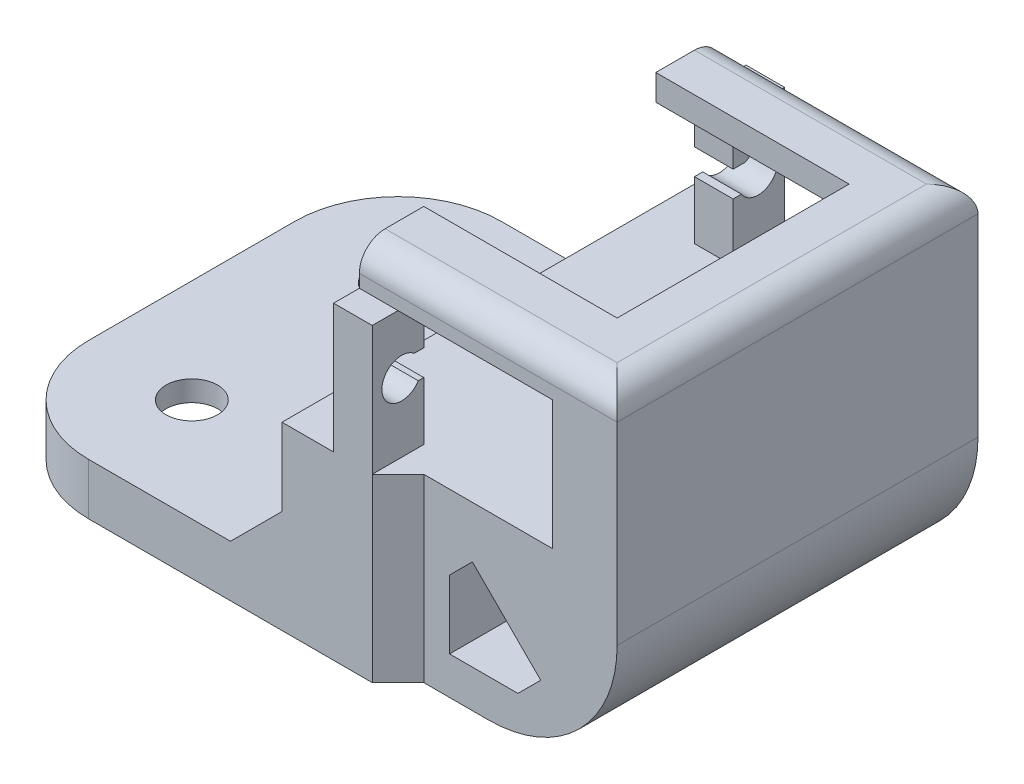
from build123d import *

# Parameters (mm, degrees)
SKETCH1_W           = 59.69
SKETCH1_H           = 50.8
BOSS_EXTRUDE1_DEPTH = 5.08
SKETCH2_W           = 30.48
SKETCH2_H           = 50.8
BOSS_EXTRUDE2_DEPTH = 12.7
SKETCH3_W           = 25.4
SKETCH3_H           = 35.56
BOSS_EXTRUDE3_DEPTH = 16.51
SKETCH5_W           = 30.48
SKETCH5_H           = 13.97
CUT_EXTRUDE1_DEPTH  = 20.32
FILLET2_R           = 2.54
FILLET3_R           = 12.7
CUT_EXTRUDE4_DEPTH  = 48.514
SKETCH12_W          = 3.81
SKETCH12_H          = 12.7
BOSS_EXTRUDE5_DEPTH = 2.54
SKETCH13_W          = 3.175
SKETCH13_H          = 2.54
CUT_EXTRUDE5_DEPTH  = 4.318
SKETCH14_R          = 2.54
CUT_EXTRUDE6_DEPTH  = 14.732
CUT_EXTRUDE7_START  = -3.048
SKETCH15_R          = 2.54
CUT_EXTRUDE7_DEPTH  = 3.048
CUT_EXTRUDE8_DEPTH  = 10.16
CUT_EXTRUDE9_START  = -17.78
CUT_EXTRUDE9_DEPTH  = 17.78
CHAMFER8_SIZE       = 2.54
CHAMFER9_SIZE       = 5.08
SKETCH20_W          = 22.86
SKETCH20_H          = 2.54
CUT_EXTRUDE10_DEPTH = 19.05
FILLET4_R           = 10.16
CUT_EXTRUDE11_DEPTH = 45.212


# Read off the part's stored shape, not the designer's step: Cut-Extrude9
with BuildPart() as part:
    # Sketch1 → Boss-Extrude1 (new body)
    with BuildSketch(Plane(origin=(0, 0, 0), x_dir=(1, 0, 0), z_dir=(0, 1, 0))):
        with Locations((29.845, 25.4)):
            Rectangle(SKETCH1_W, SKETCH1_H)
    extrude(amount=BOSS_EXTRUDE1_DEPTH)

    # Sketch2 → Boss-Extrude2 (add)
    with BuildSketch(Plane(origin=(0, 5.08, 0), x_dir=(1, 0, 0), z_dir=(0, 1, 0))):
        with Locations((44.45, 25.4)):
            Rectangle(SKETCH2_W, SKETCH2_H)
    extrude(amount=BOSS_EXTRUDE2_DEPTH)

    # Sketch3 → Boss-Extrude3 (add)
    with BuildSketch(Plane(origin=(0, 17.78, 0), x_dir=(1, 0, 0), z_dir=(0, 1, 0))):
        with Locations((46.99, 25.4)):
            Rectangle(SKETCH3_W, SKETCH3_H)
    extrude(amount=BOSS_EXTRUDE3_DEPTH)

    # Sketch5 → Cut-Extrude1 (cut)
    with BuildSketch(Plane.ZY.offset(-34.29)):
        with Locations((-25.4, 24.765)):
            Rectangle(SKETCH5_W, SKETCH5_H)
    extrude(amount=-CUT_EXTRUDE1_DEPTH, mode=Mode.SUBTRACT)

    # Fillet2
    fillet2_edges = [part.edges().sort_by_distance(p)[0] for p in [
        (59.69, 34.29, -25.4),
        (46.99, 34.29, -7.62),
        (46.99, 34.29, -43.18),
    ]]
    fillet(fillet2_edges, radius=FILLET2_R)

    # Fillet3
    fillet3_edges = [part.edges().sort_by_distance(p)[0] for p in [
        (59.69, 0, -25.4),
    ]]
    fillet(fillet3_edges, radius=FILLET3_R)

    # Sketch11 → Cut-Extrude4 (cut)
    with BuildSketch(Plane.XY.offset(-7.62)):
        Polygon((45.72, 17.78), (53.34, 17.78), (53.34, 30.48), (45.72, 30.48), (38.1, 30.48), (38.1, 17.78), align=None)
    extrude(amount=-CUT_EXTRUDE4_DEPTH, mode=Mode.SUBTRACT)

    # Sketch12 → Boss-Extrude5 (add)
    with BuildSketch(Plane.XY.offset(-7.62)):
        with Locations((36.195, 24.13)):
            Rectangle(SKETCH12_W, SKETCH12_H)
    boss_extrude5 = extrude(amount=BOSS_EXTRUDE5_DEPTH)

    # Sketch13 → Cut-Extrude5 (cut)
    with BuildSketch(Plane.ZY.offset(-34.29)):
        with Locations((-8.5725, 24.765)):
            Rectangle(SKETCH13_W, SKETCH13_H)
    cut_extrude5 = extrude(amount=-CUT_EXTRUDE5_DEPTH, mode=Mode.SUBTRACT)

    # Mirror6: Boss-Extrude5, Cut-Extrude5 across plane
    add(boss_extrude5.mirror(Plane(origin=(0, 0, -25.4), x_dir=(1, 0, 0), z_dir=(0, 0, -1))))
    add(cut_extrude5.mirror(Plane(origin=(0, 0, -25.4), x_dir=(1, 0, 0), z_dir=(0, 0, -1))), mode=Mode.SUBTRACT)

    # Sketch14 → Cut-Extrude6 (cut)
    with BuildSketch(Plane(origin=(0, 5.08, 0), x_dir=(1, 0, 0), z_dir=(0, 1, 0))):
        with Locations(Location((10.16, 15.24, 0), (0, 0, 270))):
            Circle(SKETCH14_R)
        with Locations((10.16, 39.24)):
            Circle(SKETCH14_R)
        with Locations((10.16, 35.24)):
            Circle(SKETCH14_R)
    extrude(amount=-CUT_EXTRUDE6_DEPTH, mode=Mode.SUBTRACT)

    # Sketch15 → Cut-Extrude7 (cut)
    # profile 1 of 6: a face of its own
    with BuildSketch(Plane.XZ.offset(CUT_EXTRUDE7_START)):
        with BuildLine():
            ThreePointArc((9.51, -22.611397425), (13.149879796, -22.009092908), (16.046575957, -19.724219386))
            ThreePointArc((16.046575957, -19.724219386), (16.636280729, -18.820193838), (17.08820323, -17.84))
            ThreePointArc((17.08820323, -17.84), (17.441095519, -16.561229748), (17.56, -15.24))
            ThreePointArc((17.56, -15.24), (15.617563559, -10.242500625), (10.81, -7.868602575))
            ThreePointArc((10.81, -7.868602575), (10.16, -7.84), (9.51, -7.868602575))
            ThreePointArc((9.51, -7.868602575), (8.519960283, -8.024026765), (7.56, -8.31179677))
            ThreePointArc((7.56, -8.31179677), (4.927409819, -10.007409819), (3.23179677, -12.64))
            ThreePointArc((3.23179677, -12.64), (2.838717156, -16.316483868), (4.273424043, -19.724219386))
            ThreePointArc((4.273424043, -19.724219386), (6.58709424, -21.720304347), (9.51, -22.611397425))
        make_face()
        with Locations(Location((10.16, -15.24, 0), (0, 0, 90))):
            Circle(SKETCH15_R, mode=Mode.SUBTRACT)
    # profile 2 of 6: a face of its own
    with BuildSketch(Plane.XZ.offset(CUT_EXTRUDE7_START)):
        with BuildLine():
            ThreePointArc((4.0713713, -19.878137186), (4.573160427, -20.471724342), (5.132563215, -21.011359924))
            ThreePointArc((5.132563215, -21.011359924), (5.05499215, -20.879662574), (4.975804045, -20.748931147))
            ThreePointArc((4.975804045, -20.748931147), (4.93245275, -20.678870605), (4.888637021, -20.609099577))
            ThreePointArc((4.888637021, -20.609099577), (4.811656565, -20.488952481), (4.733298943, -20.369698976))
            ThreePointArc((4.733298943, -20.369698976), (4.508518631, -20.043284953), (4.273424043, -19.724219386))
            ThreePointArc((4.273424043, -19.724219386), (2.838717156, -16.316483868), (3.23179677, -12.64))
            ThreePointArc((3.23179677, -12.64), (4.927409819, -10.007409819), (7.56, -8.31179677))
            ThreePointArc((7.56, -8.31179677), (8.519960283, -8.024026765), (9.51, -7.868602575))
            ThreePointArc((9.51, -7.868602575), (10.16, -7.84), (10.81, -7.868602575))
            ThreePointArc((10.81, -7.868602575), (15.617563559, -10.242500625), (17.56, -15.24))
            ThreePointArc((17.56, -15.24), (17.441095519, -16.561229748), (17.08820323, -17.84))
            ThreePointArc((17.08820323, -17.84), (16.636280729, -18.820193838), (16.046575957, -19.724219386))
            ThreePointArc((16.046575957, -19.724219386), (15.596911767, -20.35437693), (15.187436785, -21.011359924))
            ThreePointArc((15.187436785, -21.011359924), (15.746839573, -20.471724342), (16.2486287, -19.878137186))
            ThreePointArc((16.2486287, -19.878137186), (16.858574689, -18.943081573), (17.326009125, -17.929243243))
            ThreePointArc((17.326009125, -17.929243243), (17.691014203, -16.606580067), (17.814, -15.24))
            ThreePointArc((17.814, -15.24), (15.804890741, -10.070964836), (10.832310811, -7.615584339))
            ThreePointArc((10.832310811, -7.615584339), (3.457263585, -11.544456664), (4.0713713, -19.878137186))
        make_face()
    # profile 3 of 6: a face of its own
    with BuildSketch(Plane.XZ.offset(CUT_EXTRUDE7_START)):
        with BuildLine():
            Line((6.81, -27.24), (6.81, -39.24))
            ThreePointArc((6.81, -39.24), (10.16, -42.59), (13.51, -39.24))
            Line((13.51, -39.24), (13.51, -27.24))
            ThreePointArc((13.51, -27.24), (13.644215557, -25.420308369), (14.043957423, -23.64))
            ThreePointArc((14.043957423, -23.64), (14.539499055, -22.292533204), (15.187436785, -21.011359924))
            ThreePointArc((15.187436785, -21.011359924), (10.16, -22.894), (5.132563215, -21.011359924))
            ThreePointArc((5.132563215, -21.011359924), (5.171342294, -21.078619011), (5.209699594, -21.146119525))
            ThreePointArc((5.209699594, -21.146119525), (6.403255377, -24.089748397), (6.81, -27.24))
        make_face()
        with BuildLine():
            ThreePointArc((8.594241398, -37.24), (10.16, -32.7), (11.725758602, -37.24))
            ThreePointArc((11.725758602, -37.24), (10.16, -41.78), (8.594241398, -37.24))
        make_face(mode=Mode.SUBTRACT)
    # profile 4 of 6: a face of its own
    with BuildSketch(Plane.XZ.offset(CUT_EXTRUDE7_START)):
        with BuildLine():
            ThreePointArc((13.51, -39.24), (10.16, -42.59), (6.81, -39.24))
            Line((6.81, -39.24), (6.81, -27.24))
            ThreePointArc((6.81, -27.24), (6.403255377, -24.089748397), (5.209699594, -21.146119525))
            ThreePointArc((5.209699594, -21.146119525), (5.171342294, -21.078619011), (5.132563215, -21.011359924))
            ThreePointArc((5.132563215, -21.011359924), (4.573160427, -20.471724342), (4.0713713, -19.878137186))
            ThreePointArc((4.0713713, -19.878137186), (4.30165132, -20.19066852), (4.521828292, -20.510397817))
            ThreePointArc((4.521828292, -20.510397817), (4.598581207, -20.627209095), (4.673985158, -20.744895666))
            ThreePointArc((4.673985158, -20.744895666), (4.716903572, -20.813237833), (4.759367064, -20.881863585))
            ThreePointArc((4.759367064, -20.881863585), (4.875727352, -21.075326298), (4.988472599, -21.270917829))
            ThreePointArc((4.988472599, -21.270917829), (6.157585215, -24.154263292), (6.556, -27.24))
            Line((6.556, -27.24), (6.556, -39.24))
            ThreePointArc((6.556, -39.24), (10.16, -42.844), (13.764, -39.24))
            Line((13.764, -39.24), (13.764, -27.24))
            ThreePointArc((13.764, -27.24), (13.895466918, -25.457574349), (14.287022358, -23.71372542))
            ThreePointArc((14.287022358, -23.71372542), (15.096450182, -21.708286085), (16.2486287, -19.878137186))
            ThreePointArc((16.2486287, -19.878137186), (15.746839573, -20.471724342), (15.187436785, -21.011359924))
            ThreePointArc((15.187436785, -21.011359924), (14.539499055, -22.292533204), (14.043957423, -23.64))
            ThreePointArc((14.043957423, -23.64), (13.644215557, -25.420308369), (13.51, -27.24))
            Line((13.51, -27.24), (13.51, -39.24))
        make_face()
    # profile 5 of 6: a face of its own
    with BuildSketch(Plane.XZ.offset(CUT_EXTRUDE7_START)):
        with BuildLine():
            ThreePointArc((4.0713713, -19.878137186), (4.573160427, -20.471724342), (5.132563215, -21.011359924))
            ThreePointArc((5.132563215, -21.011359924), (5.05499215, -20.879662574), (4.975804045, -20.748931147))
            ThreePointArc((4.975804045, -20.748931147), (4.93245275, -20.678870605), (4.888637021, -20.609099577))
            ThreePointArc((4.888637021, -20.609099577), (4.811656565, -20.488952481), (4.733298943, -20.369698976))
            ThreePointArc((4.733298943, -20.369698976), (4.508518631, -20.043284953), (4.273424043, -19.724219386))
            ThreePointArc((4.273424043, -19.724219386), (2.838717156, -16.316483868), (3.23179677, -12.64))
            ThreePointArc((3.23179677, -12.64), (4.927409819, -10.007409819), (7.56, -8.31179677))
            ThreePointArc((7.56, -8.31179677), (8.519960283, -8.024026765), (9.51, -7.868602575))
            ThreePointArc((9.51, -7.868602575), (10.16, -7.84), (10.81, -7.868602575))
            ThreePointArc((10.81, -7.868602575), (15.617563559, -10.242500625), (17.56, -15.24))
            ThreePointArc((17.56, -15.24), (17.441095519, -16.561229748), (17.08820323, -17.84))
            ThreePointArc((17.08820323, -17.84), (16.636280729, -18.820193838), (16.046575957, -19.724219386))
            ThreePointArc((16.046575957, -19.724219386), (15.596911767, -20.35437693), (15.187436785, -21.011359924))
            ThreePointArc((15.187436785, -21.011359924), (15.746839573, -20.471724342), (16.2486287, -19.878137186))
            ThreePointArc((16.2486287, -19.878137186), (16.858574689, -18.943081573), (17.326009125, -17.929243243))
            ThreePointArc((17.326009125, -17.929243243), (17.691014203, -16.606580067), (17.814, -15.24))
            ThreePointArc((17.814, -15.24), (15.804890741, -10.070964836), (10.832310811, -7.615584339))
            ThreePointArc((10.832310811, -7.615584339), (3.457263585, -11.544456664), (4.0713713, -19.878137186))
        make_face()
    # profile 6 of 6: a face of its own
    with BuildSketch(Plane.XZ.offset(CUT_EXTRUDE7_START)):
        with BuildLine():
            ThreePointArc((4.975804045, -20.748931147), (5.05499215, -20.879662574), (5.132563215, -21.011359924))
            ThreePointArc((5.132563215, -21.011359924), (10.16, -22.894), (15.187436785, -21.011359924))
            ThreePointArc((15.187436785, -21.011359924), (15.596911767, -20.35437693), (16.046575957, -19.724219386))
            ThreePointArc((16.046575957, -19.724219386), (13.149879796, -22.009092908), (9.51, -22.611397425))
            ThreePointArc((9.51, -22.611397425), (6.58709424, -21.720304347), (4.273424043, -19.724219386))
            ThreePointArc((4.273424043, -19.724219386), (4.508518631, -20.043284953), (4.733298943, -20.369698976))
            ThreePointArc((4.733298943, -20.369698976), (4.811656565, -20.488952481), (4.888637021, -20.609099577))
            ThreePointArc((4.888637021, -20.609099577), (4.93245275, -20.678870605), (4.975804045, -20.748931147))
        make_face()
    extrude(amount=CUT_EXTRUDE7_DEPTH, mode=Mode.SUBTRACT)

    # Sketch16 → Cut-Extrude8 (cut)
    with BuildSketch(Plane.ZY.offset(-34.29)):
        with BuildLine():
            Line((-43.815, 26.035), (-41.856211186, 26.035))
            ThreePointArc((-41.856211186, 26.035), (-45.021919195, 24.23561484), (-41.456672525, 23.495))
            Line((-41.456672525, 23.495), (-43.815, 23.495))
            Line((-43.815, 23.495), (-43.815, 26.035))
        make_face()
        with BuildLine():
            ThreePointArc((-41.153556271, 24.538), (-41.337956779, 25.364851397), (-41.856211186, 26.035))
            Line((-41.856211186, 26.035), (-43.815, 26.035))
            Line((-43.815, 26.035), (-43.815, 23.495))
            Line((-43.815, 23.495), (-41.456672525, 23.495))
            ThreePointArc((-41.456672525, 23.495), (-41.230871202, 23.994923471), (-41.153556271, 24.538))
        make_face()
        with BuildLine():
            Line((-6.985, 26.035), (-9.216271419, 26.035))
            ThreePointArc((-9.216271419, 26.035), (-9.895289259, 24.84038516), (-9.615810079, 23.495))
            Line((-9.615810079, 23.495), (-6.985, 23.495))
            Line((-6.985, 23.495), (-6.985, 26.035))
        make_face()
        with BuildLine():
            ThreePointArc((-6.026926334, 24.538), (-7.146074937, 26.299599491), (-9.216271419, 26.035))
            Line((-9.216271419, 26.035), (-6.985, 26.035))
            Line((-6.985, 26.035), (-6.985, 23.495))
            Line((-6.985, 23.495), (-9.615810079, 23.495))
            ThreePointArc((-9.615810079, 23.495), (-7.429849805, 22.669314932), (-6.026926334, 24.538))
        make_face()
    extrude(amount=-CUT_EXTRUDE8_DEPTH, mode=Mode.SUBTRACT)

    # Cut-Extrude9 outline → Cut-Extrude9 (cut)
    with BuildSketch(Plane(origin=(0, 17.78, 0), x_dir=(1, 0, 0), z_dir=(0, 1, 0)).offset(CUT_EXTRUDE9_START)):
        Polygon((38.1, 45.72), (38.1, 43.18), (59.69, 43.18), (59.69, 50.8), (0, 50.8), (0, 45.72), align=None)
        Polygon((0, 0), (59.69, 0), (59.69, 7.62), (38.1, 7.62), (38.1, 5.08), (0, 5.08), align=None)
    extrude(amount=CUT_EXTRUDE9_DEPTH, mode=Mode.SUBTRACT)

    # Chamfer8
    chamfer8_edges = [part.edges().sort_by_distance(p)[0] for p in [
        (38.1, 8.89, -43.18),
        (38.1, 8.89, -7.62),
    ]]
    chamfer(chamfer8_edges, length=CHAMFER8_SIZE - 0.0001)  # a hair under: the kernel refuses the full size

    # Chamfer9
    chamfer9_edges = [part.edges().sort_by_distance(p)[0] for p in [
        (29.21, 5.08, -25.4),
    ]]
    chamfer(chamfer9_edges, length=CHAMFER9_SIZE)

    # Sketch20 → Cut-Extrude10 (cut)
    with BuildSketch(Plane.ZY.offset(-34.29)):
        with Locations((-25.4, 33.02)):
            Rectangle(SKETCH20_W, SKETCH20_H)
    extrude(amount=-CUT_EXTRUDE10_DEPTH, mode=Mode.SUBTRACT)

    # Fillet4
    fillet4_edges = [part.edges().sort_by_distance(p)[0] for p in [
        (0, 2.54, -45.72),
        (0, 2.54, -5.08),
    ]]
    fillet(fillet4_edges, radius=FILLET4_R)

    # Sketch21 → Cut-Extrude11 (cut)
    with BuildSketch(Plane.XY.offset(-7.62)):
        Polygon((43.18, 10.45493597), (43.18, 3.719743879), (49.915192091, 3.719743879), align=None)
        Polygon((45.42506403, 12.7), (43.18, 10.45493597), (47.670128061, 10.45493597), align=None)
        Polygon((47.670128061, 10.45493597), (43.18, 10.45493597), (49.915192091, 3.719743879), (49.915192091, 8.209871939), align=None)
        Polygon((49.915192091, 8.209871939), (49.915192091, 3.719743879), (52.160256121, 5.964807909), align=None)
    extrude(amount=-CUT_EXTRUDE11_DEPTH, mode=Mode.SUBTRACT)


solid = part.part
